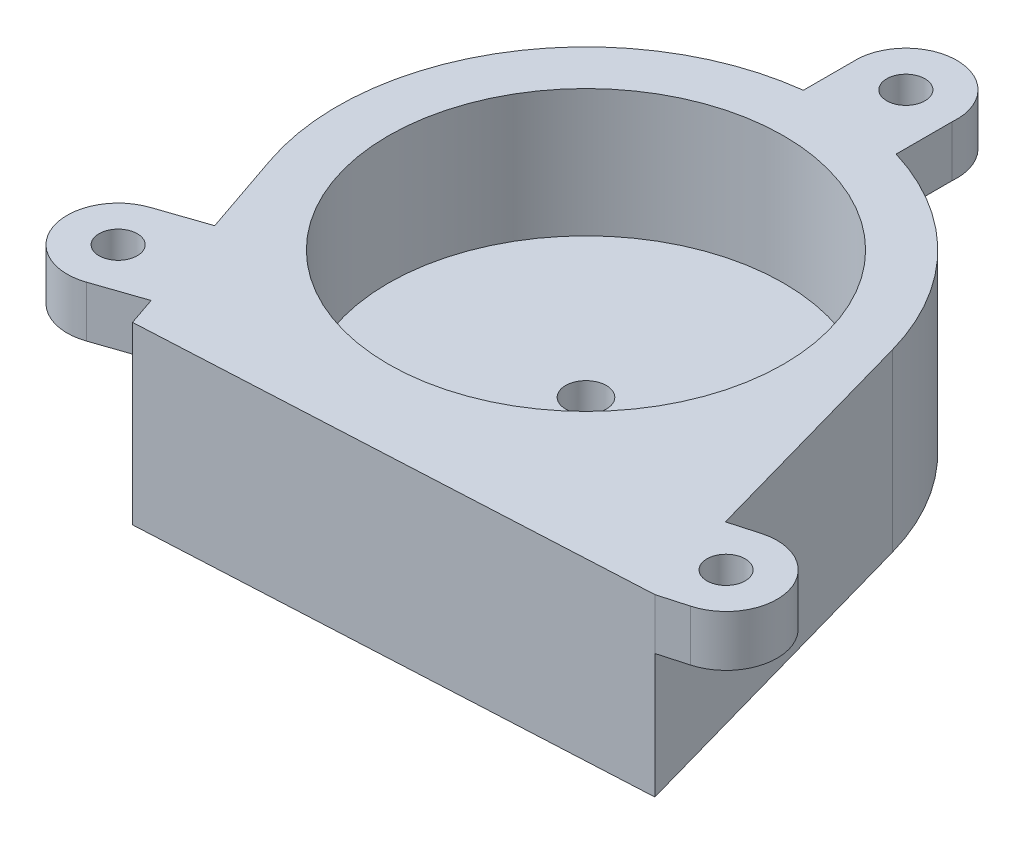
from build123d import *

# Parameters (mm, degrees)
SALIENTE_EXTRUIR1_DEPTH = 13.746
CROQUIS2_R              = 15.5
CORTAR_EXTRUIR1_DEPTH   = 10
CROQUIS3_R              = 1.6
CORTAR_EXTRUIR2_DEPTH   = 10
SALIENTE_EXTRUIR2_START = -4
CROQUIS4_R              = 1.5
SALIENTE_EXTRUIR2_DEPTH = 4
CORTAR_EXTRUIR3_DEPTH   = 45.978374576
CROQUIS6_R              = 1.5
CORTAR_EXTRUIR4_DEPTH   = 44.749194214
CROQUIS7_R              = 2.05
CORTAR_EXTRUIR5_DEPTH   = 6
CROQUIS8_R              = 4
CORTAR_EXTRUIR6_DEPTH   = 0.746


# Read off the part's stored shape, not the designer's step: Saliente-Extruir1
with BuildPart() as part:
    # Saliente-Extruir1 outline → Saliente-Extruir1 (new body)
    with BuildSketch(Plane(origin=(0, 0, 0), x_dir=(1, 0, 0), z_dir=(0, 1, 0))):
        with BuildLine():
            Line((26.09194434, -20.692720824), (18.78711178, 5.224407236))
            ThreePointArc((18.78711178, 5.224407236), (-5.766161796, 18.627973001), (-18.453215474, -6.30308168))
            Line((-18.453215474, -6.30308168), (-12.857048648, -22.686698065))
            Line((-12.857048648, -22.686698065), (26.09194434, -20.692720824))
        make_face()
    extrude(amount=SALIENTE_EXTRUIR1_DEPTH)

    # Croquis2 → Cortar-Extruir1 (cut)
    with BuildSketch(Plane(origin=(0, 13.746, 0), x_dir=(1, 0, 0), z_dir=(0, 1, 0))):
        with Locations(Location((0, 0, 0), (0, 0, 270))):
            Circle(CROQUIS2_R)
    extrude(amount=-CORTAR_EXTRUIR1_DEPTH, mode=Mode.SUBTRACT)

    # Croquis3 → Cortar-Extruir2 (cut)
    with BuildSketch(Plane(origin=(0, 3.746, 0), x_dir=(1, 0, 0), z_dir=(0, 1, 0))):
        with Locations(Location((0, 0, 0), (0, 0, 270))):
            Circle(CROQUIS3_R)
    extrude(amount=-CORTAR_EXTRUIR2_DEPTH, mode=Mode.SUBTRACT)

    # Croquis4 → Saliente-Extruir2 (add)
    # profile 1 of 3: a face of its own
    with BuildSketch(Plane(origin=(0, 13.746, 0), x_dir=(1, 0, 0), z_dir=(0, 1, 0)).offset(SALIENTE_EXTRUIR2_START)):
        with BuildLine():
            Line((-17.399016653, -21.764305721), (-13.613741684, -20.471365889))
            Line((-13.613741684, -20.471365889), (-16.199621348, -12.900815951))
            Line((-16.199621348, -12.900815951), (-19.984896317, -14.193755782))
            ThreePointArc((-19.984896317, -14.193755782), (-22.477231454, -19.271970583), (-17.399016653, -21.764305721))
        make_face()
        with Locations(Location((-18.691956485, -17.979030752, 0), (0, 0, 270))):
            Circle(CROQUIS4_R, mode=Mode.SUBTRACT)
    # profile 2 of 3: a face of its own
    with BuildSketch(Plane(origin=(0, 13.746, 0), x_dir=(1, 0, 0), z_dir=(0, 1, 0)).offset(SALIENTE_EXTRUIR2_START)):
        with BuildLine():
            Line((23.921673943, -12.992725603), (26.09194434, -20.692720824))
            Line((26.09194434, -20.692720824), (29.941941951, -19.607585626))
            ThreePointArc((29.941941951, -19.607585626), (32.75563819, -14.658688833), (27.771671554, -11.907590405))
            Line((27.771671554, -11.907590405), (23.921673943, -12.992725603))
        make_face()
    # profile 3 of 3: a face of its own
    with BuildSketch(Plane(origin=(0, 13.746, 0), x_dir=(1, 0, 0), z_dir=(0, 1, 0)).offset(SALIENTE_EXTRUIR2_START)):
        with BuildLine():
            Line((-2.321, 23.759), (-2.321, 19.361378024))
            ThreePointArc((-2.321, 19.361378024), (1.699637522, 19.425787816), (5.648, 18.664139305))
            Line((5.648, 18.664139305), (5.648, 23.062))
            ThreePointArc((5.648, 23.062), (2.012, 27.395), (-2.321, 23.759))
        make_face()
        with Locations(Location((1.6635, 23.4105, 0), (0, 0, 270))):
            Circle(CROQUIS4_R, mode=Mode.SUBTRACT)
    extrude(amount=SALIENTE_EXTRUIR2_DEPTH)

    # Croquis5 → Cortar-Extruir3 (cut, through all)
    with BuildSketch(Plane(origin=(0, 13.746, 0), x_dir=(1, 0, 0), z_dir=(0, 1, 0))):
        with BuildLine():
            Line((25.521809268, -10.120190748), (26.141320794, -12.367178003))
            ThreePointArc((26.141320794, -12.367178003), (31.060606452, -15.160138551), (28.267645904, -20.079424208))
            Line((28.267645904, -20.079424208), (28.88715743, -22.326411463))
            ThreePointArc((28.88715743, -22.326411463), (33.307593706, -14.540627024), (25.521809268, -10.120190748))
        make_face()
    extrude(amount=-CORTAR_EXTRUIR3_DEPTH, mode=Mode.SUBTRACT)

    # Croquis6 → Cortar-Extruir4 (cut, through all)
    with BuildSketch(Plane(origin=(0, 13.746, 0), x_dir=(1, 0, 0), z_dir=(0, 1, 0))):
        with Locations(Location((27.204483349, -16.223301105, 0), (0, 0, 270))):
            Circle(CROQUIS6_R)
    extrude(amount=-CORTAR_EXTRUIR4_DEPTH, mode=Mode.SUBTRACT)

    # Croquis7 → Cortar-Extruir5 (cut)
    with BuildSketch(Plane.XZ):
        with Locations(Location((7.549608222, 17.636749548, 0), (0, 0, 270))):
            Circle(CROQUIS7_R)
    extrude(amount=-CORTAR_EXTRUIR5_DEPTH, mode=Mode.SUBTRACT)

    # Croquis8 → Cortar-Extruir6 (cut)
    with BuildSketch(Plane.XZ):
        with Locations(Location((0, 0, 0), (0, 0, 270))):
            Circle(CROQUIS8_R)
    extrude(amount=-CORTAR_EXTRUIR6_DEPTH, mode=Mode.SUBTRACT)


solid = part.part
